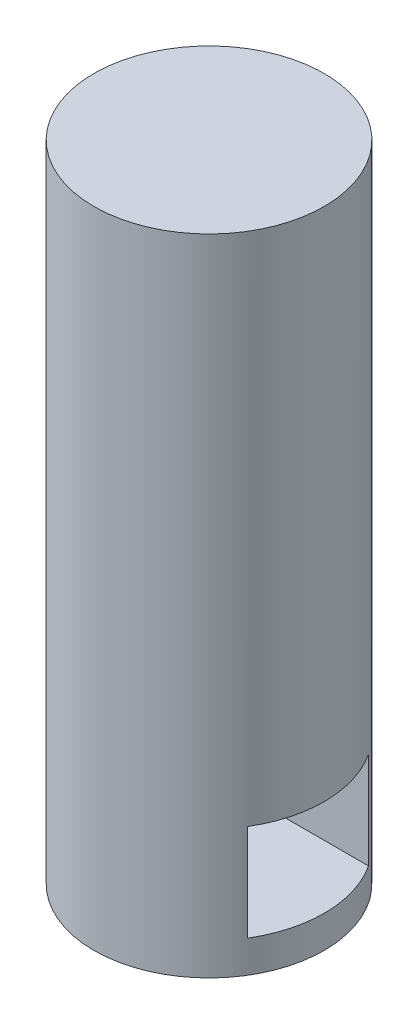
from build123d import *

# Parameters (mm, degrees)
SKETCH1_R           = 7.15
BOSS_EXTRUDE1_DEPTH = 40
SKETCH2_R           = 1
CUT_EXTRUDE1_DEPTH  = 4
SKETCH3_W           = 14.94180525
SKETCH3_H           = 7.642607054
CUT_EXTRUDE2_DEPTH  = 6


with BuildPart() as part:
    # Sketch1 → Boss-Extrude1 (new body)
    with BuildSketch(Plane(origin=(0, 0, 0), x_dir=(1, 0, 0), z_dir=(0, 1, 0))):
        Circle(SKETCH1_R)
    extrude(amount=BOSS_EXTRUDE1_DEPTH)

    # Sketch2 → Cut-Extrude1 (cut)
    with BuildSketch(Plane.XZ):
        Circle(SKETCH2_R)
    extrude(amount=-CUT_EXTRUDE1_DEPTH, mode=Mode.SUBTRACT)

    # Sketch3 → Cut-Extrude2 (cut)
    with BuildSketch(Plane(origin=(0, 2, 0), x_dir=(1, 0, 0), z_dir=(0, 1, 0))):
        with Locations((-0.076828784, 0.097224969)):
            Rectangle(SKETCH3_W, SKETCH3_H)
    extrude(amount=CUT_EXTRUDE2_DEPTH, mode=Mode.SUBTRACT)


solid = part.part
